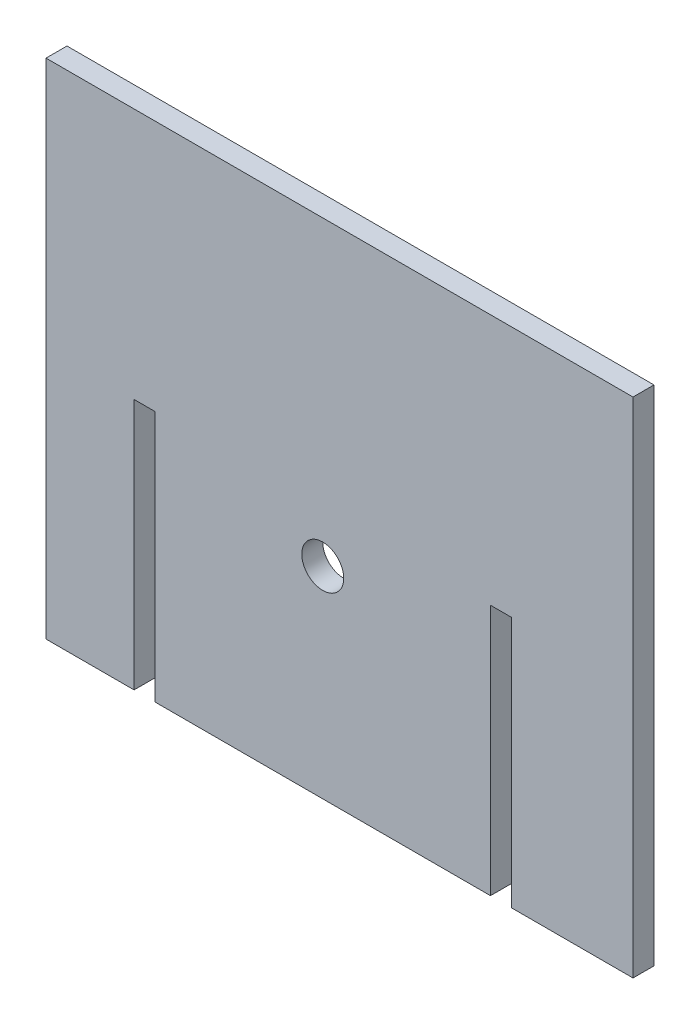
from build123d import *

# Parameters (mm, degrees)
BOSS_EXTRUDE1_DEPTH = 6.35
CAVITY1_START       = -6.35
CAVITY1_OUTLINE_R   = 12.7
CAVITY1_DEPTH       = 12.7


# Read off the part's stored shape, not the designer's step: Cavity1
with BuildPart() as part:
    # Sketch1 → Boss-Extrude1 (new, symmetric)
    with BuildSketch(Plane.XY):
        Polygon((785.7, 533.4), (785.7, 381), (732.36, 381), (732.36, 685.8), (785.7, 685.8), (1001.6, 685.8), (1087.96, 685.8), (1087.96, 381), (1014.3, 381), (1014.3, 533.4), (1001.6, 533.4), (1001.6, 381), (798.4, 381), (798.4, 533.4), align=None)
    extrude(amount=BOSS_EXTRUDE1_DEPTH, both=True)

    # Cavity1 outline → Cavity1 (cut)
    with BuildSketch(Plane.XY.offset(CAVITY1_START)):
        with Locations((900, 503.049546279)):
            Circle(CAVITY1_OUTLINE_R)
    extrude(amount=CAVITY1_DEPTH, mode=Mode.SUBTRACT)


solid = part.part
